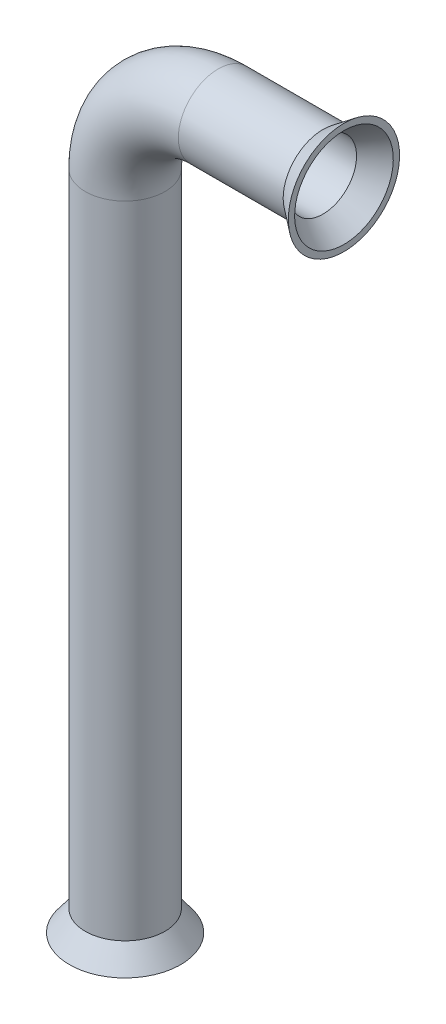
from build123d import *

# Parameters (mm, degrees)
SKETCH1_R           = 4.826
SKETCH1_R_2         = 4.064
SKETCH3_R           = 4.826
BOSS_EXTRUDE1_DEPTH = 2.54
BOSS_EXTRUDE1_DRAFT = -37
SKETCH5_R           = 4.826
BOSS_EXTRUDE2_DEPTH = 2.54
BOSS_EXTRUDE2_DRAFT = -37


with BuildPart() as part:
    # Sweep1: sweep along a path in Sketch2
    with BuildLine(Plane.XY) as sweep1_path:
        Line((0, 0), (0, 77.6224))
        ThreePointArc((0, 77.6224), (3.303132564, 85.596867436), (11.2776, 88.9))
        Line((11.2776, 88.9), (23.9776, 88.9))
    # Sketch1 → Sweep1 (sweep)
    with BuildSketch(Plane(origin=(0, 0, 0), x_dir=(1, 0, 0), z_dir=(0, 1, 0))):
        Circle(SKETCH1_R)
        Circle(SKETCH1_R_2, mode=Mode.SUBTRACT)
    sweep(path=sweep1_path.line)


with BuildPart() as boss_extrude1_tool:
    # Sketch3 → Boss-Extrude1 (with draft: the straight prism first)
    with BuildSketch(Plane.XZ):
        Circle(SKETCH3_R)
    extrude(amount=BOSS_EXTRUDE1_DEPTH)
    # Boss-Extrude1: the draft: its side faces are tilted about the plane it starts from
    boss_extrude1_sides = [boss_extrude1_tool.faces().sort_by_distance(p)[0] for p in [
        (-4.826, -1.27, 0),
    ]]
    draft(boss_extrude1_sides, Plane.XZ, BOSS_EXTRUDE1_DRAFT)


with BuildPart() as part_1:
    add(part.part)

    # Boss-Extrude1: add boss_extrude1_tool
    add(boss_extrude1_tool.part)

    # Cut-Extrude1 cone 1 section (through the dimple's axis) → Cut-Extrude1 (revolve, cut)
    with BuildSketch(Plane(origin=(0, -2.54, 0), x_dir=(0, 0, -1), z_dir=(1, 0, 0))):
        Polygon((0, 0), (5.978027287, 0), (0, 7.933110155), align=None)
    revolve(axis=Axis((0, -2.54, 0), (0, 1, 0)), mode=Mode.SUBTRACT)


with BuildPart() as boss_extrude2_tool:
    # Sketch5 → Boss-Extrude2 (with draft: the straight prism first)
    with BuildSketch(Plane(origin=(23.9776, 0, 0), x_dir=(0, 0, -1), z_dir=(1, 0, 0))):
        with Locations((0, 88.9)):
            Circle(SKETCH5_R)
    extrude(amount=BOSS_EXTRUDE2_DEPTH)
    # Boss-Extrude2: the draft: its side faces are tilted about the plane it starts from
    boss_extrude2_sides = [boss_extrude2_tool.faces().sort_by_distance(p)[0] for p in [
        (25.2476, 88.9, 4.826),
    ]]
    draft(boss_extrude2_sides, Plane(origin=(23.9776, 0, 0), x_dir=(0, 0, -1), z_dir=(1, 0, 0)), BOSS_EXTRUDE2_DRAFT)


with BuildPart() as part_2:
    add(part_1.part)

    # Boss-Extrude2: add boss_extrude2_tool
    add(boss_extrude2_tool.part)

    # Cut-Extrude2 cone 1 section (through the dimple's axis) → Cut-Extrude2 (revolve, cut)
    with BuildSketch(Plane(origin=(26.5176, 88.9, 0), x_dir=(0, 0, -1), z_dir=(0, 1, 0))):
        Polygon((0, 0), (5.978027287, 0), (0, 7.933110155), align=None)
    revolve(axis=Axis((26.5176, 88.9, 0), (-1, 0, 0)), mode=Mode.SUBTRACT)


solid = part_2.part
